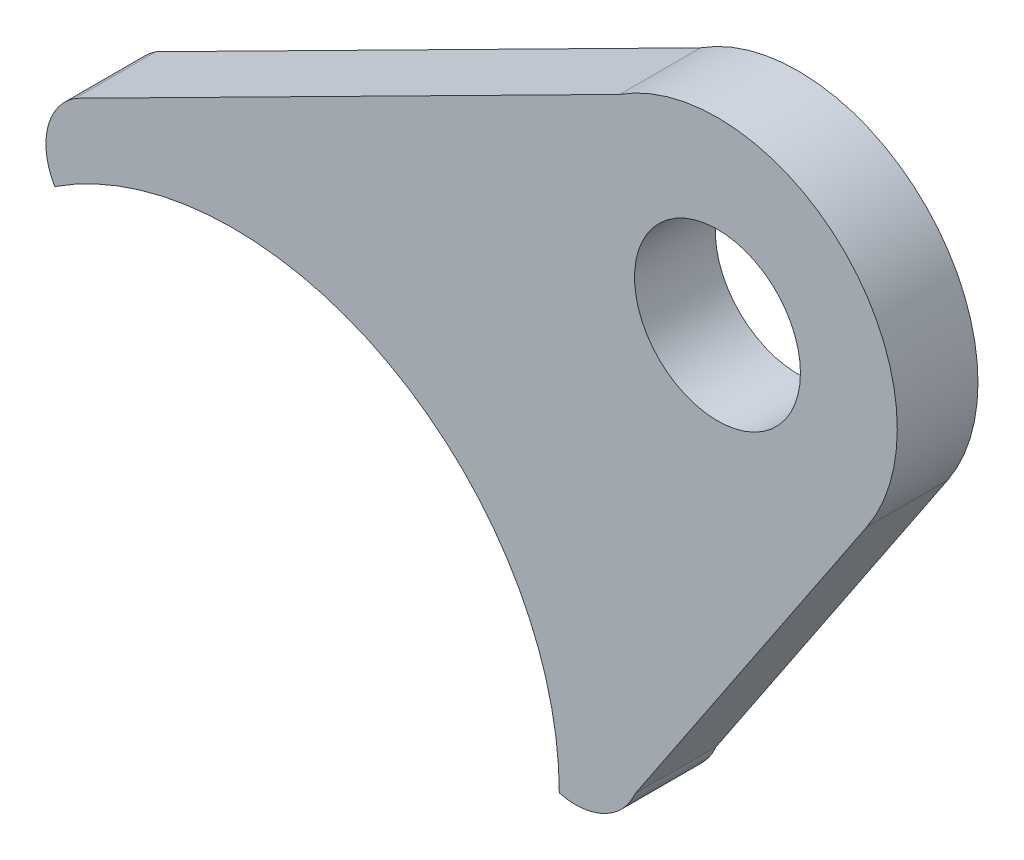
from build123d import *

# Parameters (mm, degrees)
SKETCH1_R           = 3.2639
BOSS_EXTRUDE1_DEPTH = 3.175


with BuildPart() as part:
    # Sketch1 → Boss-Extrude1 (new body)
    with BuildSketch(Plane.XY):
        with BuildLine():
            Line((-6.212966782, 14.14638443), (15.202863294, 24.986295173))
            ThreePointArc((15.202863294, 24.986295173), (24.086776856, 24.016985012), (24.932040386, 15.120411967))
            Line((24.932040386, 15.120411967), (15.811536469, 1.468300871))
            ThreePointArc((15.811536469, 1.468300871), (14.593034605, 0.17768021), (12.827, 0))
            ThreePointArc((12.827, 0), (6.100484701, 11.283439875), (-7.024253671, 10.732743795))
            ThreePointArc((-7.024253671, 10.732743795), (-7.302758898, 12.602159097), (-6.212966782, 14.14638443))
        make_face()
        with Locations((19.05, 19.05)):
            Circle(SKETCH1_R, mode=Mode.SUBTRACT)
    extrude(amount=BOSS_EXTRUDE1_DEPTH)


solid = part.part
